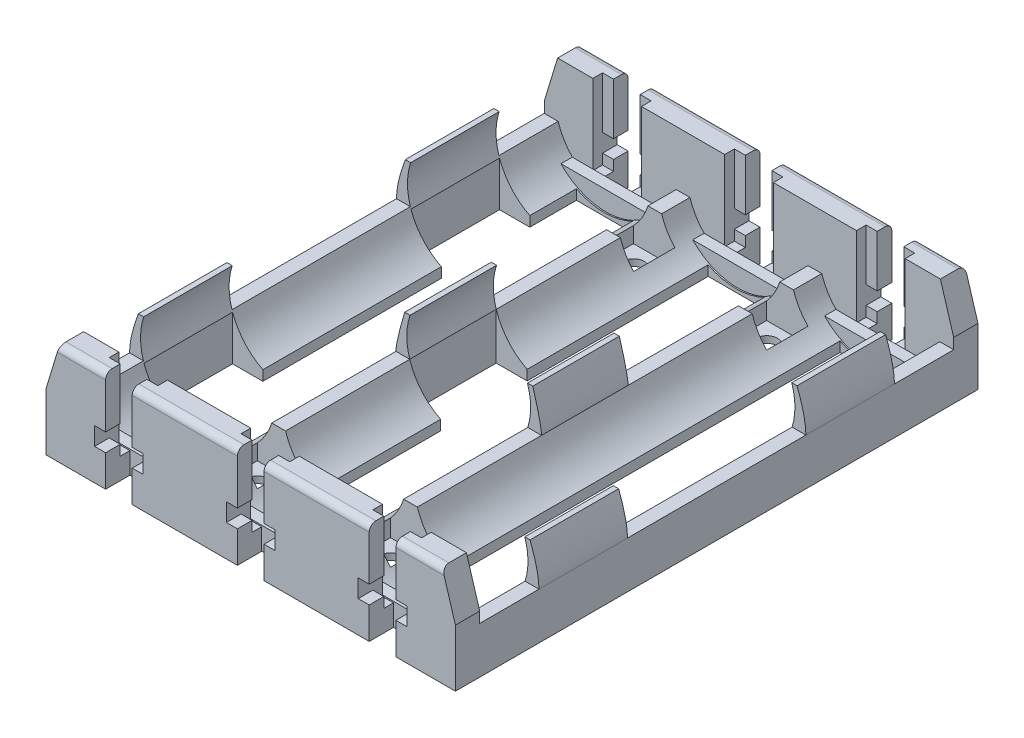
from build123d import *

# Parameters (mm, degrees)
SKETCH1_W                      = 61.5
SKETCH1_H                      = 78.5
BOSS_EXTRUDE1_DEPTH            = 7
BOSS_EXTRUDE2_DEPTH            = 3.65
CUT_EXTRUDE1_REACH             = 54.126
SKETCH3_R                      = 9.3
CUT_EXTRUDE1_DIRECTION_2_REACH = 54.126
SKETCH4_W                      = 8.45
SKETCH4_H                      = 67.4
SKETCH4_W_2                    = 4.55
SKETCH4_H_2                    = 13.3
SKETCH4_W_3                    = 4.643483523
SKETCH4_H_3                    = 13
SKETCH4_R                      = 1.6
CUT_EXTRUDE2_DEPTH             = 53.126432834
SKETCH7_W                      = 6.2
SKETCH7_H                      = 6.2
CUT_EXTRUDE4_DEPTH             = 6
SKETCH6_W                      = 61.5
SKETCH6_H                      = 5.35
BOSS_EXTRUDE3_DEPTH            = 3.4
CUT_EXTRUDE3_DEPTH             = 12
SKETCH8_W                      = 4
SKETCH8_H                      = 3.65
CUT_EXTRUDE5_DEPTH             = 52.28474432
SKETCH9_W                      = 7.3
SKETCH9_H                      = 2.7
CUT_EXTRUDE6_DEPTH             = 86.667102787
BOSS_EXTRUDE4_DEPTH            = 13.3
BOSS_EXTRUDE5_START            = 13.3
BOSS_EXTRUDE5_DEPTH            = 13.3
BOSS_EXTRUDE7_DEPTH            = 13
SKETCH14_R                     = 0.725
BOSS_EXTRUDE8_DEPTH            = 0.9
WRAP1_OUTLINE_W                = 3
WRAP1_OUTLINE_H                = 0.269230769
WRAP1_OUTLINE_W_2              = 2.192307693
WRAP1_OUTLINE_W_3              = 0.307692308
WRAP1_OUTLINE_H_2              = 1.153846154
WRAP1_DEPTH                    = 0.1
FILLET1_R                      = 1


# Read off the part's stored shape, not the designer's step: Wrap1
with BuildPart() as part:
    # Sketch1 → Boss-Extrude1 (new body)
    with BuildSketch(Plane(origin=(0, 0, 0), x_dir=(1, 0, 0), z_dir=(0, 1, 0))):
        Rectangle(SKETCH1_W, SKETCH1_H)
    extrude(amount=BOSS_EXTRUDE1_DEPTH)

    # Sketch2 → Boss-Extrude2 (add)
    with BuildSketch(Plane.XY.offset(39.25)):
        Polygon((-30.75, 0), (-30.75, 8.6), (-28.75, 15.2), (28.75, 15.2), (30.75, 8.6), (30.75, 0), align=None)
    boss_extrude2 = extrude(amount=-BOSS_EXTRUDE2_DEPTH)

    # Mirror1: Boss-Extrude2 across plane
    add(boss_extrude2.mirror(Plane.XY))

    # Cut-Extrude1: up to this face of the body (flat: up to its plane)
    cut_extrude1_end = Plane(part.part.faces().sort_by_distance((0, 11.048930971, 35.6))[0])
    # Sketch3 → Cut-Extrude1 (cut, up to the picked face)
    with BuildSketch(Plane.XY, mode=Mode.PRIVATE) as cut_extrude1_sk1:
        with Locations((0, 9.8)):
            Circle(SKETCH3_R)
    cut_extrude1_tool1 = split(extrude(cut_extrude1_sk1.sketch, amount=CUT_EXTRUDE1_REACH, mode=Mode.PRIVATE), bisect_by=cut_extrude1_end, keep=Keep.BOTH, mode=Mode.PRIVATE)
    # Sketch3 → Cut-Extrude1 (cut, up to the picked face)
    with BuildSketch(Plane.XY, mode=Mode.PRIVATE) as cut_extrude1_sk2:
        with Locations((-19.8, 9.8)):
            Circle(SKETCH3_R)
    cut_extrude1_tool2 = split(extrude(cut_extrude1_sk2.sketch, amount=CUT_EXTRUDE1_REACH, mode=Mode.PRIVATE), bisect_by=cut_extrude1_end, keep=Keep.BOTH, mode=Mode.PRIVATE)
    # Sketch3 → Cut-Extrude1 (cut, up to the picked face)
    with BuildSketch(Plane.XY, mode=Mode.PRIVATE) as cut_extrude1_sk3:
        with Locations((19.8, 9.8)):
            Circle(SKETCH3_R)
    cut_extrude1_tool3 = split(extrude(cut_extrude1_sk3.sketch, amount=CUT_EXTRUDE1_REACH, mode=Mode.PRIVATE), bisect_by=cut_extrude1_end, keep=Keep.BOTH, mode=Mode.PRIVATE)
    add(cut_extrude1_tool1.solids().sort_by(Axis((0, 9.8, 0), (0, 0, 1)))[0], mode=Mode.SUBTRACT)
    add(cut_extrude1_tool2.solids().sort_by(Axis((-19.8, 9.8, 0), (0, 0, 1)))[0], mode=Mode.SUBTRACT)
    add(cut_extrude1_tool3.solids().sort_by(Axis((19.8, 9.8, 0), (0, 0, 1)))[0], mode=Mode.SUBTRACT)

    # Cut-Extrude1 direction 2: up to this face of the body (flat: up to its plane)
    cut_extrude1_direction_2_end = Plane(part.part.faces().sort_by_distance((0, 11.048930971, -35.6))[0])
    # Sketch3 → Cut-Extrude1 direction 2 (cut, up to the picked face)
    with BuildSketch(Plane.XY, mode=Mode.PRIVATE) as cut_extrude1_direction_2_sk1:
        with Locations((0, 9.8)):
            Circle(SKETCH3_R)
    cut_extrude1_direction_2_tool1 = split(extrude(cut_extrude1_direction_2_sk1.sketch, amount=-CUT_EXTRUDE1_DIRECTION_2_REACH, mode=Mode.PRIVATE), bisect_by=cut_extrude1_direction_2_end, keep=Keep.BOTH, mode=Mode.PRIVATE)
    # Sketch3 → Cut-Extrude1 direction 2 (cut, up to the picked face)
    with BuildSketch(Plane.XY, mode=Mode.PRIVATE) as cut_extrude1_direction_2_sk2:
        with Locations((-19.8, 9.8)):
            Circle(SKETCH3_R)
    cut_extrude1_direction_2_tool2 = split(extrude(cut_extrude1_direction_2_sk2.sketch, amount=-CUT_EXTRUDE1_DIRECTION_2_REACH, mode=Mode.PRIVATE), bisect_by=cut_extrude1_direction_2_end, keep=Keep.BOTH, mode=Mode.PRIVATE)
    # Sketch3 → Cut-Extrude1 direction 2 (cut, up to the picked face)
    with BuildSketch(Plane.XY, mode=Mode.PRIVATE) as cut_extrude1_direction_2_sk3:
        with Locations((19.8, 9.8)):
            Circle(SKETCH3_R)
    cut_extrude1_direction_2_tool3 = split(extrude(cut_extrude1_direction_2_sk3.sketch, amount=-CUT_EXTRUDE1_DIRECTION_2_REACH, mode=Mode.PRIVATE), bisect_by=cut_extrude1_direction_2_end, keep=Keep.BOTH, mode=Mode.PRIVATE)
    add(cut_extrude1_direction_2_tool1.solids().sort_by(Axis((0, 9.8, 0), (0, 0, -1)))[0], mode=Mode.SUBTRACT)
    add(cut_extrude1_direction_2_tool2.solids().sort_by(Axis((-19.8, 9.8, 0), (0, 0, -1)))[0], mode=Mode.SUBTRACT)
    add(cut_extrude1_direction_2_tool3.solids().sort_by(Axis((19.8, 9.8, 0), (0, 0, -1)))[0], mode=Mode.SUBTRACT)

    # Sketch4 → Cut-Extrude2 (cut, through all)
    with BuildSketch(Plane.XZ):
        with Locations((-19.8, 0)):
            Rectangle(SKETCH4_W, SKETCH4_H)
        with Locations((-26.3, 20.05)):
            Rectangle(SKETCH4_W_2, SKETCH4_H_2)
        with Locations((-26.3, -20.05)):
            Rectangle(SKETCH4_W_2, SKETCH4_H_2)
        with Locations((-6.546741761, 0)):
            Rectangle(SKETCH4_W_3, SKETCH4_H_3)
        Rectangle(SKETCH4_W, SKETCH4_H)
        with Locations((6.546741761, 0)):
            Rectangle(SKETCH4_W_3, SKETCH4_H_3)
        with Locations((19.8, 0)):
            Rectangle(SKETCH4_W, SKETCH4_H)
        with Locations((26.3, 20.05)):
            Rectangle(SKETCH4_W_2, SKETCH4_H_2)
        with Locations((26.3, -20.05)):
            Rectangle(SKETCH4_W_2, SKETCH4_H_2)
        with Locations(Location((-10, 28.25, 0), (0, 0, 270))):
            Circle(SKETCH4_R)
        with Locations(Location((10, 28.25, 0), (0, 0, 270))):
            Circle(SKETCH4_R)
        with Locations(Location((-10, -28.25, 0), (0, 0, 270))):
            Circle(SKETCH4_R)
        with Locations(Location((10, -28.25, 0), (0, 0, 270))):
            Circle(SKETCH4_R)
    extrude(amount=-CUT_EXTRUDE2_DEPTH, mode=Mode.SUBTRACT)

    # Sketch7 → Cut-Extrude4 (cut)
    with BuildSketch(Plane(origin=(0, 7, 0), x_dir=(1, 0, 0), z_dir=(0, 1, 0))):
        with Locations((-10, 28.25)):
            Rectangle(SKETCH7_W, SKETCH7_H)
        with Locations((10, 28.25)):
            Rectangle(SKETCH7_W, SKETCH7_H)
        with Locations((10, -28.25)):
            Rectangle(SKETCH7_W, SKETCH7_H)
        with Locations((-10, -28.25)):
            Rectangle(SKETCH7_W, SKETCH7_H)
    extrude(amount=-CUT_EXTRUDE4_DEPTH, mode=Mode.SUBTRACT)

    # Sketch6 → Boss-Extrude3 (add)
    with BuildSketch(Plane.XZ):
        with Locations((0, -36.575)):
            Rectangle(SKETCH6_W, SKETCH6_H)
        with Locations((0, 36.575)):
            Rectangle(SKETCH6_W, SKETCH6_H)
    extrude(amount=-BOSS_EXTRUDE3_DEPTH)

    # Sketch5 → Cut-Extrude3 (cut)
    with BuildSketch(Plane(origin=(0, 15.2, 0), x_dir=(1, 0, 0), z_dir=(0, 1, 0))):
        Polygon((-23.45, 35.6), (-23.45, 37.05), (-21.8, 37.05), (-21.8, 39.25), (-17.8, 39.25), (-17.8, 37.05), (-16.15, 37.05), (-16.15, 35.6), align=None)
        Polygon((-3.65, 35.6), (-3.65, 37.05), (-2, 37.05), (-2, 39.25), (2, 39.25), (2, 37.05), (3.65, 37.05), (3.65, 35.6), align=None)
        Polygon((16.15, 35.6), (16.15, 37.05), (17.8, 37.05), (17.8, 39.25), (21.8, 39.25), (21.8, 37.05), (23.45, 37.05), (23.45, 35.6), align=None)
        Polygon((16.15, -35.6), (23.45, -35.6), (23.45, -37.05), (21.8, -37.05), (21.8, -39.25), (17.8, -39.25), (17.8, -37.05), (16.15, -37.05), align=None)
        Polygon((-3.65, -35.6), (3.65, -35.6), (3.65, -37.05), (2, -37.05), (2, -39.25), (-2, -39.25), (-2, -37.05), (-3.65, -37.05), align=None)
        Polygon((-16.15, -35.6), (-16.15, -37.05), (-17.8, -37.05), (-17.8, -39.25), (-21.8, -39.25), (-21.8, -37.05), (-23.45, -37.05), (-23.45, -35.6), align=None)
    extrude(amount=-CUT_EXTRUDE3_DEPTH, mode=Mode.SUBTRACT)

    # Sketch8 → Cut-Extrude5 (cut, through all)
    with BuildSketch(Plane(origin=(0, 3.2, 0), x_dir=(1, 0, 0), z_dir=(0, 1, 0))):
        with Locations((-19.8, 37.425)):
            Rectangle(SKETCH8_W, SKETCH8_H)
        with Locations((0, 37.425)):
            Rectangle(SKETCH8_W, SKETCH8_H)
        with Locations((19.8, 37.425)):
            Rectangle(SKETCH8_W, SKETCH8_H)
        with Locations((-19.8, -37.425)):
            Rectangle(SKETCH8_W, SKETCH8_H)
        with Locations((0, -37.425)):
            Rectangle(SKETCH8_W, SKETCH8_H)
        with Locations((19.8, -37.425)):
            Rectangle(SKETCH8_W, SKETCH8_H)
    extrude(amount=-CUT_EXTRUDE5_DEPTH, mode=Mode.SUBTRACT)

    # Sketch9 → Cut-Extrude6 (cut, through all)
    with BuildSketch(Plane.XY.offset(39.25)):
        with Locations((-19.8, 6.1)):
            Rectangle(SKETCH9_W, SKETCH9_H)
        with Locations((0, 6.1)):
            Rectangle(SKETCH9_W, SKETCH9_H)
        with Locations((19.8, 6.1)):
            Rectangle(SKETCH9_W, SKETCH9_H)
    extrude(amount=-CUT_EXTRUDE6_DEPTH, mode=Mode.SUBTRACT)

    # Sketch10 → Boss-Extrude4 (add)
    with BuildSketch(Plane.XY.offset(-26.7)):
        with BuildLine():
            Line((-28.668483523, 7), (-30.75, 7))
            add(Edge.make_bspline(
                [(-30.75, 7), (-30.75, 9.219569762), (-29.419722218, 12.75)],
                knots=[0, 0, 0, 1, 1, 1], degree=2))
            Line((-29.419722218, 12.75), (-28.619722218, 12.75))
            ThreePointArc((-28.619722218, 12.75), (-29.099665617, 9.878863276), (-28.668483523, 7))
        make_face()
        with BuildLine():
            Line((29.419722218, 12.75), (28.619722218, 12.75))
            ThreePointArc((28.619722218, 12.75), (29.099665617, 9.878863276), (28.668483523, 7))
            Line((28.668483523, 7), (30.75, 7))
            add(Edge.make_bspline(
                [(30.75, 7), (30.75, 9.219569762), (29.419722218, 12.75)],
                knots=[0, 0, 0, 1, 1, 1], degree=2))
        make_face()
    extrude(amount=BOSS_EXTRUDE4_DEPTH)

    # Sketch11 → Boss-Extrude5 (add)
    with BuildSketch(Plane(origin=(0, 0, 26.7), x_dir=(-1, 0, 0), z_dir=(0, 0, -1)).offset(BOSS_EXTRUDE5_START)):
        with BuildLine():
            Line((28.668483523, 7), (30.75, 7))
            add(Edge.make_bspline(
                [(30.75, 7), (30.75, 9.219569768), (29.41972221, 12.750000021)],
                knots=[0, 0, 0, 1, 1, 1], degree=2))
            Line((29.41972221, 12.750000021), (28.619722218, 12.75))
            ThreePointArc((28.619722218, 12.75), (29.099665617, 9.878863276), (28.668483523, 7))
        make_face()
        with BuildLine():
            Line((-28.619722218, 12.75), (-29.419722218, 12.75))
            add(Edge.make_bspline(
                [(-29.419722218, 12.75), (-30.75, 9.219569762), (-30.75, 7)],
                knots=[0, 0, 0, 1, 1, 1], degree=2))
            Line((-30.75, 7), (-28.668483523, 7))
            ThreePointArc((-28.668483523, 7), (-29.099665617, 9.878863276), (-28.619722218, 12.75))
        make_face()
    extrude(amount=-BOSS_EXTRUDE5_DEPTH)

    # Sketch13 → Boss-Extrude7 (add)
    with BuildSketch(Plane.XY.offset(-6.5)):
        with BuildLine():
            Line((-10.931516477, 7), (-8.868483523, 7))
            ThreePointArc((-8.868483523, 7), (-9.299665617, 9.878863276), (-8.819722218, 12.75))
            Line((-8.819722218, 12.75), (-9.619722218, 12.75))
            add(Edge.make_bspline(
                [(-10.931516477, 7), (-10.931516477, 8.305537982), (-9.619722218, 12.75)],
                knots=[0, 0, 0, 1, 1, 1], degree=2))
        make_face()
        with BuildLine():
            Line((8.819722218, 12.75), (9.619722218, 12.75))
            add(Edge.make_bspline(
                [(10.931516477, 7), (10.931516477, 8.305537982), (9.619722218, 12.75)],
                knots=[0, 0, 0, 1, 1, 1], degree=2))
            Line((10.931516477, 7), (8.868483523, 7))
            ThreePointArc((8.868483523, 7), (9.299665617, 9.878863276), (8.819722218, 12.75))
        make_face()
    extrude(amount=BOSS_EXTRUDE7_DEPTH)

    # Sketch14 → Boss-Extrude8 (add)
    with BuildSketch(Plane.XZ):
        with Locations(Location((-27.85, 36.35, 0), (0, 0, 90))):
            Circle(SKETCH14_R)
    extrude(amount=BOSS_EXTRUDE8_DEPTH)

    # Wrap1 outline → Wrap1 (add)
    # profile 1 of 19: a face of its own
    with BuildSketch(Plane.XZ):
        with BuildLine():
            add(Edge.make_bspline(
                [(-11.566626863, -16.209812051), (-11.751117703, -16.225297601), (-12.119936822, -16.256255056), (-12.643114884, -16.574624246), (-13.068112696, -17.10104244), (-13.117598594, -17.57095043), (-13.142348017, -17.805965897)],
                knots=[0, 0, 0, 0, 0.22042865, 0.440663071, 0.720258365, 1, 1, 1, 1], degree=3))
            add(Edge.make_bspline(
                [(-13.142348017, -17.805965897), (-13.124214407, -17.987854162), (-13.087944376, -18.351658878), (-12.773789792, -18.86996631), (-12.246520729, -19.280544656), (-11.783680066, -19.335949223), (-11.552203787, -19.363658204)],
                knots=[0, 0, 0, 0, 0.220319519, 0.440673179, 0.720268979, 1, 1, 1, 1], degree=3))
            add(Edge.make_bspline(
                [(-11.552203787, -19.363658204), (-11.36970047, -19.347512507), (-11.004761052, -19.315227058), (-10.48974599, -18.996488434), (-10.065686356, -18.47932206), (-10.014229189, -18.014384733), (-9.988501863, -17.781927435)],
                knots=[0, 0, 0, 0, 0.220363612, 0.440646063, 0.720336705, 1, 1, 1, 1], degree=3))
            add(Edge.make_bspline(
                [(-9.988501863, -17.781927435), (-10.004172718, -17.599071212), (-10.035501164, -17.233513531), (-10.352654736, -16.716647882), (-10.868282073, -16.2889856), (-11.333873699, -16.23620001), (-11.566626863, -16.209812051)],
                knots=[0, 0, 0, 0, 0.220417275, 0.440647992, 0.720375232, 1, 1, 1, 1], degree=3))
        make_face()
        with BuildLine():
            add(Edge.make_bspline(
                [(-12.83465571, -17.792744743), (-12.777606236, -17.496456186), (-12.683935036, -17.009971341), (-12.134869079, -16.548952544), (-11.756458057, -16.502348091), (-11.567227825, -16.47904282)],
                knots=[0, 0, 0, 0, 0.43782334, 0.718874943, 1, 1, 1, 1], degree=3))
            add(Edge.make_bspline(
                [(-11.567227825, -16.47904282), (-11.268161078, -16.539144726), (-10.776193348, -16.638012949), (-10.362793763, -17.226062298), (-10.318401145, -17.603790095), (-10.296194171, -17.792744743)],
                knots=[0, 0, 0, 0, 0.436559263, 0.718144265, 1, 1, 1, 1], degree=3))
            add(Edge.make_bspline(
                [(-10.296194171, -17.792744743), (-10.35249173, -18.08620325), (-10.445040725, -18.568627183), (-10.990339435, -19.024680792), (-11.36577479, -19.071185719), (-11.55340571, -19.094427435)],
                knots=[0, 0, 0, 0, 0.437205081, 0.718732595, 1, 1, 1, 1], degree=3))
            add(Edge.make_bspline(
                [(-11.55340571, -19.094427435), (-11.850671206, -19.034142078), (-12.339758493, -18.934955318), (-12.760668418, -18.356727827), (-12.809995329, -17.980723478), (-12.83465571, -17.792744743)],
                knots=[0, 0, 0, 0, 0.436602165, 0.718336204, 1, 1, 1, 1], degree=3))
        make_face(mode=Mode.SUBTRACT)
    # profile 2 of 19: a face of its own
    with BuildSketch(Plane.XZ):
        with BuildLine():
            Line((-10.06542494, -13.671350512), (-11.450040325, -14.773513974))
            add(Edge.make_bspline(
                [(-11.450040325, -14.773513974), (-11.459019449, -14.546682265), (-11.473684287, -14.176217364), (-11.834024495, -13.764497934), (-12.119985172, -13.728055612), (-12.263141287, -13.709812051)],
                knots=[0, 0, 0, 0, 0.440919364, 0.720116024, 1, 1, 1, 1], degree=3))
            add(Edge.make_bspline(
                [(-12.263141287, -13.709812051), (-12.423518371, -13.732699589), (-12.786209689, -13.784459548), (-12.939212482, -14.124628443), (-13.024559556, -14.314379358)],
                knots=[0, 0, 0, 0, 0.442186169, 1, 1, 1, 1], degree=3))
            add(Edge.make_bspline(
                [(-13.024559556, -14.314379358), (-13.037390559, -14.413564849), (-13.066567822, -14.639109272), (-13.065835318, -14.866611235), (-13.06542494, -14.994066858)],
                knots=[0, 0, 0, 0, 0.439760335, 1, 1, 1, 1], degree=3))
            Line((-13.06542494, -14.994066858), (-13.06542494, -15.594427435))
            Line((-13.06542494, -15.594427435), (-10.06542494, -15.594427435))
            Line((-10.06542494, -15.594427435), (-10.06542494, -15.325196666))
            Line((-10.06542494, -15.325196666), (-11.450040325, -15.325196666))
            Line((-11.450040325, -15.325196666), (-11.450040325, -15.106446666))
            Line((-11.450040325, -15.106446666), (-10.06542494, -14.004283204))
            Line((-10.06542494, -14.004283204), (-10.06542494, -13.671350512))
        make_face()
        with BuildLine():
            Line((-12.757732633, -15.325196666), (-12.757732633, -14.762696666))
            add(Edge.make_bspline(
                [(-12.757732633, -14.762696666), (-12.761223195, -14.582696651), (-12.766452474, -14.31303516), (-12.526525245, -14.023832671), (-12.351280658, -13.993963239), (-12.263742248, -13.97904282)],
                knots=[0, 0, 0, 0, 0.501181356, 0.750829446, 1, 1, 1, 1], degree=3))
            add(Edge.make_bspline(
                [(-12.263742248, -13.97904282), (-12.173922184, -13.993183962), (-11.994261383, -14.021469501), (-11.750514172, -14.318074414), (-11.752320068, -14.592606897), (-11.753525902, -14.77591782)],
                knots=[0, 0, 0, 0, 0.249363761, 0.498784916, 1, 1, 1, 1], degree=3))
            Line((-11.753525902, -14.77591782), (-11.757732633, -15.325196666))
            Line((-11.757732633, -15.325196666), (-12.757732633, -15.325196666))
        make_face(mode=Mode.SUBTRACT)
    # profile 3 of 19: a face of its own
    with BuildSketch(Plane.XZ):
        with BuildLine():
            add(Edge.make_bspline(
                [(-12.948838402, -9.709812051), (-13.005743705, -9.723500529), (-13.134789106, -9.754542191), (-13.164307771, -9.886978347), (-13.180809556, -9.961013974)],
                knots=[0, 0, 0, 0, 0.440971187, 1, 1, 1, 1], degree=3))
            add(Edge.make_bspline(
                [(-13.180809556, -9.961013974), (-13.170804064, -10.018640591), (-13.148302298, -10.148239491), (-13.020058264, -10.187827174), (-12.948838402, -10.209812051)],
                knots=[0, 0, 0, 0, 0.444653605, 1, 1, 1, 1], degree=3))
            add(Edge.make_bspline(
                [(-12.948838402, -10.209812051), (-12.89272251, -10.195968493), (-12.765498861, -10.164582946), (-12.735845135, -10.033999555), (-12.719271094, -9.961013974)],
                knots=[0, 0, 0, 0, 0.441080669, 1, 1, 1, 1], degree=3))
            add(Edge.make_bspline(
                [(-12.719271094, -9.961013974), (-12.728912753, -9.90338234), (-12.750584356, -9.773843436), (-12.878070579, -9.73266839), (-12.948838402, -9.709812051)],
                knots=[0, 0, 0, 0, 0.444898268, 1, 1, 1, 1], degree=3))
        make_face()
    # profile 4 of 19: a face of its own
    with BuildSketch(Plane.XZ):
        with BuildLine():
            add(Edge.make_bspline(
                [(-10.026963402, -5.843225512), (-10.076678837, -5.582168908), (-10.158499848, -5.152525378), (-10.659370697, -4.772425027), (-10.990236478, -4.730674614), (-11.155569171, -4.709812051)],
                knots=[0, 0, 0, 0, 0.436530256, 0.718435765, 1, 1, 1, 1], degree=3))
            add(Edge.make_bspline(
                [(-11.155569171, -4.709812051), (-11.282624887, -4.719087156), (-11.570874594, -4.740129472), (-11.804416051, -4.913398129), (-11.935016287, -5.01029282)],
                knots=[0, 0, 0, 0, 0.440783502, 1, 1, 1, 1], degree=3))
            add(Edge.make_bspline(
                [(-11.935016287, -5.01029282), (-12.029676414, -5.113344909), (-12.244413632, -5.347119355), (-12.277623709, -5.665303057), (-12.296194171, -5.843225512)],
                knots=[0, 0, 0, 0, 0.440818453, 1, 1, 1, 1], degree=3))
            add(Edge.make_bspline(
                [(-12.296194171, -5.843225512), (-12.285400457, -5.983258191), (-12.260931559, -6.300706417), (-12.05070492, -6.54309555), (-11.933213402, -6.678562051)],
                knots=[0, 0, 0, 0, 0.441119741, 1, 1, 1, 1], degree=3))
            add(Edge.make_bspline(
                [(-11.933213402, -6.678562051), (-11.833092905, -6.756879597), (-11.605909147, -6.934590207), (-11.317099581, -6.963098313), (-11.155569171, -6.97904282)],
                knots=[0, 0, 0, 0, 0.440702704, 1, 1, 1, 1], degree=3))
            add(Edge.make_bspline(
                [(-11.155569171, -6.97904282), (-10.896044644, -6.925476869), (-10.469405271, -6.837418358), (-10.078851193, -6.343111219), (-10.044267012, -6.00992807), (-10.026963402, -5.843225512)],
                knots=[0, 0, 0, 0, 0.436926873, 0.718275876, 1, 1, 1, 1], degree=3))
        make_face()
        with BuildLine():
            add(Edge.make_bspline(
                [(-12.026963402, -5.844427435), (-11.984353163, -5.64636705), (-11.914229197, -5.320417701), (-11.535197753, -5.024428473), (-11.280878812, -4.994167647), (-11.153766287, -4.97904282)],
                knots=[0, 0, 0, 0, 0.436502568, 0.718355301, 1, 1, 1, 1], degree=3))
            add(Edge.make_bspline(
                [(-11.153766287, -4.97904282), (-10.947000051, -5.019633411), (-10.48061678, -5.111189814), (-10.362143525, -5.582222342), (-10.296194171, -5.844427435)],
                knots=[0, 0, 0, 0, 0.443339733, 1, 1, 1, 1], degree=3))
            add(Edge.make_bspline(
                [(-10.296194171, -5.844427435), (-10.334518462, -6.051782156), (-10.420989209, -6.519634715), (-10.891685226, -6.64179426), (-11.153766287, -6.709812051)],
                knots=[0, 0, 0, 0, 0.443205271, 1, 1, 1, 1], degree=3))
            add(Edge.make_bspline(
                [(-11.153766287, -6.709812051), (-11.352405472, -6.669053425), (-11.679190687, -6.602000612), (-11.979197792, -6.225659316), (-12.011046997, -5.971461111), (-12.026963402, -5.844427435)],
                knots=[0, 0, 0, 0, 0.436762215, 0.718526077, 1, 1, 1, 1], degree=3))
        make_face(mode=Mode.SUBTRACT)
    # profile 5 of 19: a face of its own
    with BuildSketch(Plane.XZ):
        with BuildLine():
            add(Edge.make_bspline(
                [(-10.85809321, -3.902119743), (-10.944852683, -3.902224429), (-11.141879967, -3.902462167), (-11.33715013, -3.875655789), (-11.446434556, -3.860653397)],
                knots=[0, 0, 0, 0, 0.440342428, 1, 1, 1, 1], degree=3))
            add(Edge.make_bspline(
                [(-11.446434556, -3.860653397), (-11.587372701, -3.797184001), (-11.905837573, -3.653768087), (-11.9836097, -3.3077476), (-12.026963402, -3.114860128)],
                knots=[0, 0, 0, 0, 0.44255476, 1, 1, 1, 1], degree=3))
            add(Edge.make_bspline(
                [(-12.026963402, -3.114860128), (-12.015603273, -2.994636075), (-11.990015605, -2.723842232), (-11.736458594, -2.611706353), (-11.595473017, -2.54935532)],
                knots=[0, 0, 0, 0, 0.44396893, 1, 1, 1, 1], degree=3))
            add(Edge.make_bspline(
                [(-11.595473017, -2.54935532), (-11.522744594, -2.539145944), (-11.357357221, -2.515929412), (-11.190280407, -2.516938828), (-11.09667494, -2.517504358)],
                knots=[0, 0, 0, 0, 0.43974592, 1, 1, 1, 1], degree=3))
            Line((-11.09667494, -2.517504358), (-10.06542494, -2.517504358))
            Line((-10.06542494, -2.517504358), (-10.06542494, -2.248273589))
            Line((-10.06542494, -2.248273589), (-11.185016287, -2.248273589))
            add(Edge.make_bspline(
                [(-11.185016287, -2.248273589), (-11.421407314, -2.249421067), (-11.807300809, -2.251294251), (-12.234938689, -2.625117561), (-12.275761736, -2.920261813), (-12.296194171, -3.067985128)],
                knots=[0, 0, 0, 0, 0.441272869, 0.720350226, 1, 1, 1, 1], degree=3))
            add(Edge.make_bspline(
                [(-12.296194171, -3.067985128), (-12.281064923, -3.214045692), (-12.246745159, -3.545375042), (-12.000174419, -3.774179565), (-11.86229994, -3.902119743)],
                knots=[0, 0, 0, 0, 0.440831955, 1, 1, 1, 1], degree=3))
            Line((-11.86229994, -3.902119743), (-12.257732633, -3.902119743))
            Line((-12.257732633, -3.902119743), (-12.257732633, -4.171350512))
            Line((-12.257732633, -4.171350512), (-10.06542494, -4.171350512))
            Line((-10.06542494, -4.171350512), (-10.06542494, -3.902119743))
            Line((-10.06542494, -3.902119743), (-10.85809321, -3.902119743))
        make_face()
    # profile 6 of 19: a face of its own
    with BuildSketch(Plane.XZ):
        with BuildLine():
            add(Edge.make_bspline(
                [(-12.372516287, 1.790187949), (-12.251332526, 1.810611172), (-11.975839051, 1.857040367), (-11.822556034, 2.095001727), (-11.736698979, 2.228288911)],
                knots=[0, 0, 0, 0, 0.439878877, 1, 1, 1, 1], degree=3))
            add(Edge.make_bspline(
                [(-11.736698979, 2.228288911), (-11.657520909, 2.085309508), (-11.479409791, 1.763677251), (-11.116284204, 1.681813552), (-10.914583594, 1.636341796)],
                knots=[0, 0, 0, 0, 0.444543109, 1, 1, 1, 1], degree=3))
            add(Edge.make_bspline(
                [(-10.914583594, 1.636341796), (-10.690316551, 1.686921535), (-10.321833105, 1.770026909), (-10.016410708, 2.220122403), (-9.997824983, 2.507306336), (-9.988501863, 2.651365834)],
                knots=[0, 0, 0, 0, 0.43662127, 0.717393461, 1, 1, 1, 1], degree=3))
            add(Edge.make_bspline(
                [(-9.988501863, 2.651365834), (-9.995359511, 2.784730694), (-10.010866057, 3.086295953), (-10.207920255, 3.318260063), (-10.317828787, 3.447639872)],
                knots=[0, 0, 0, 0, 0.442242124, 1, 1, 1, 1], degree=3))
            add(Edge.make_bspline(
                [(-10.317828787, 3.447639872), (-10.399002691, 3.506882767), (-10.58320894, 3.641321432), (-10.81152094, 3.662793392), (-10.939223017, 3.674803334)],
                knots=[0, 0, 0, 0, 0.440668567, 1, 1, 1, 1], degree=3))
            add(Edge.make_bspline(
                [(-10.939223017, 3.674803334), (-11.094840301, 3.648014524), (-11.449388546, 3.586980652), (-11.633434141, 3.271747426), (-11.736698979, 3.094875449)],
                knots=[0, 0, 0, 0, 0.438917088, 1, 1, 1, 1], degree=3))
            add(Edge.make_bspline(
                [(-11.736698979, 3.094875449), (-11.799787442, 3.198763912), (-11.941935376, 3.43284047), (-12.213220284, 3.48946429), (-12.364102825, 3.52095718)],
                knots=[0, 0, 0, 0, 0.44382258, 1, 1, 1, 1], degree=3))
            add(Edge.make_bspline(
                [(-12.364102825, 3.52095718), (-12.55566968, 3.47348634), (-12.989965364, 3.365866568), (-13.087715338, 2.919095839), (-13.142348017, 2.66939468)],
                knots=[0, 0, 0, 0, 0.441097765, 1, 1, 1, 1], degree=3))
            add(Edge.make_bspline(
                [(-13.142348017, 2.66939468), (-13.112922114, 2.470727359), (-13.046901506, 2.02499297), (-12.61301575, 1.873924188), (-12.372516287, 1.790187949)],
                knots=[0, 0, 0, 0, 0.44570786, 1, 1, 1, 1], degree=3))
        make_face()
        with BuildLine():
            add(Edge.make_bspline(
                [(-12.83465571, 2.654370642), (-12.825231719, 2.785376051), (-12.804201094, 3.077728376), (-12.527196046, 3.189848313), (-12.374319171, 3.251726411)],
                knots=[0, 0, 0, 0, 0.44810798, 1, 1, 1, 1], degree=3))
            add(Edge.make_bspline(
                [(-12.374319171, 3.251726411), (-12.248692122, 3.214967243), (-11.962971612, 3.131363845), (-11.905384285, 2.832593453), (-11.873117248, 2.665187949)],
                knots=[0, 0, 0, 0, 0.439685094, 1, 1, 1, 1], degree=3))
            add(Edge.make_bspline(
                [(-11.873117248, 2.665187949), (-11.89202732, 2.533751471), (-11.934359758, 2.239515344), (-12.21373331, 2.123570518), (-12.368309556, 2.059418719)],
                knots=[0, 0, 0, 0, 0.446704081, 1, 1, 1, 1], degree=3))
            add(Edge.make_bspline(
                [(-12.368309556, 2.059418719), (-12.490102122, 2.099187578), (-12.768697128, 2.190157051), (-12.810901628, 2.487190461), (-12.83465571, 2.654370642)],
                knots=[0, 0, 0, 0, 0.437167083, 1, 1, 1, 1], degree=3))
        make_face(mode=Mode.SUBTRACT)
        with BuildLine():
            add(Edge.make_bspline(
                [(-11.56542494, 2.671798526), (-11.541039954, 2.835722494), (-11.486363824, 3.203273571), (-11.130800264, 3.333452235), (-10.933814363, 3.405572565)],
                knots=[0, 0, 0, 0, 0.445989626, 1, 1, 1, 1], degree=3))
            add(Edge.make_bspline(
                [(-10.933814363, 3.405572565), (-10.770203, 3.361448873), (-10.398234376, 3.261134149), (-10.332830169, 2.872219932), (-10.296194171, 2.654370642)],
                knots=[0, 0, 0, 0, 0.439852591, 1, 1, 1, 1], degree=3))
            add(Edge.make_bspline(
                [(-10.296194171, 2.654370642), (-10.311708691, 2.486356452), (-10.346328951, 2.111437028), (-10.706695289, 1.978780935), (-10.905569171, 1.905572565)],
                knots=[0, 0, 0, 0, 0.448134131, 1, 1, 1, 1], degree=3))
            add(Edge.make_bspline(
                [(-10.905569171, 1.905572565), (-11.071366507, 1.952051425), (-11.448533589, 2.057784704), (-11.523444058, 2.451278859), (-11.56542494, 2.671798526)],
                knots=[0, 0, 0, 0, 0.439585913, 1, 1, 1, 1], degree=3))
        make_face(mode=Mode.SUBTRACT)
    # profile 7 of 19: a face of its own
    with BuildSketch(Plane.XZ):
        with BuildLine():
            add(Edge.make_bspline(
                [(-9.988501863, 5.006534103), (-10.028584534, 5.221071012), (-10.094406123, 5.573371902), (-10.498306636, 5.896910461), (-10.770973422, 5.928321212), (-10.907372056, 5.944034103)],
                knots=[0, 0, 0, 0, 0.437654663, 0.718692779, 1, 1, 1, 1], degree=3))
            add(Edge.make_bspline(
                [(-10.907372056, 5.944034103), (-11.111814027, 5.903426553), (-11.448135705, 5.836624225), (-11.750213315, 5.445564033), (-11.780868222, 5.184920169), (-11.796194171, 5.054611026)],
                knots=[0, 0, 0, 0, 0.43667806, 0.718366671, 1, 1, 1, 1], degree=3))
            add(Edge.make_bspline(
                [(-11.796194171, 5.054611026), (-11.795086096, 5.008759393), (-11.792568257, 4.904572377), (-11.776400507, 4.801580258), (-11.767348017, 4.743913911)],
                knots=[0, 0, 0, 0, 0.440089706, 1, 1, 1, 1], degree=3))
            Line((-11.767348017, 4.743913911), (-12.97948744, 5.53658218))
            Line((-12.97948744, 5.53658218), (-13.142348017, 5.328649488))
            Line((-13.142348017, 5.328649488), (-11.773357633, 4.433216796))
            add(Edge.make_bspline(
                [(-11.773357633, 4.433216796), (-11.656483528, 4.355545068), (-11.391898996, 4.179708533), (-11.077489671, 4.12719638), (-10.901963402, 4.097880257)],
                knots=[0, 0, 0, 0, 0.441726901, 1, 1, 1, 1], degree=3))
            add(Edge.make_bspline(
                [(-10.901963402, 4.097880257), (-10.691487945, 4.138371874), (-10.345725317, 4.204890261), (-10.037363108, 4.606764505), (-10.004792836, 4.873245733), (-9.988501863, 5.006534103)],
                knots=[0, 0, 0, 0, 0.437445392, 0.718621881, 1, 1, 1, 1], degree=3))
        make_face()
        with BuildLine():
            add(Edge.make_bspline(
                [(-11.488501863, 4.998120642), (-11.465708798, 5.152116851), (-11.414626447, 5.497243248), (-11.077722634, 5.611518158), (-10.891146094, 5.674803334)],
                knots=[0, 0, 0, 0, 0.44620235, 1, 1, 1, 1], degree=3))
            add(Edge.make_bspline(
                [(-10.891146094, 5.674803334), (-10.7444055, 5.638433158), (-10.411322327, 5.555877313), (-10.337496085, 5.212858327), (-10.296194171, 5.02095718)],
                knots=[0, 0, 0, 0, 0.440552407, 1, 1, 1, 1], degree=3))
            add(Edge.make_bspline(
                [(-10.296194171, 5.02095718), (-10.320288695, 4.870482623), (-10.374385229, 4.532640216), (-10.70679255, 4.426163278), (-10.891146094, 4.367111026)],
                knots=[0, 0, 0, 0, 0.445398666, 1, 1, 1, 1], degree=3))
            add(Edge.make_bspline(
                [(-10.891146094, 4.367111026), (-11.038708216, 4.397934551), (-11.372316646, 4.467620373), (-11.44690534, 4.808191427), (-11.488501863, 4.998120642)],
                knots=[0, 0, 0, 0, 0.442321322, 1, 1, 1, 1], degree=3))
        make_face(mode=Mode.SUBTRACT)
    # profile 8 of 19: a face of its own
    with BuildSketch(Plane.XZ):
        with BuildLine():
            add(Edge.make_bspline(
                [(-11.719271094, 7.258937949), (-11.698258318, 7.430905934), (-11.651157554, 7.816377302), (-11.268793691, 7.923283083), (-11.057011479, 7.982495642)],
                knots=[0, 0, 0, 0, 0.446123884, 1, 1, 1, 1], degree=3))
            add(Edge.make_bspline(
                [(-11.057011479, 7.982495642), (-10.874712943, 7.947167636), (-10.462980316, 7.867377129), (-10.355876663, 7.452348262), (-10.296194171, 7.221077372)],
                knots=[0, 0, 0, 0, 0.44275951, 1, 1, 1, 1], degree=3))
            add(Edge.make_bspline(
                [(-10.296194171, 7.221077372), (-10.317399681, 7.079461247), (-10.365157105, 6.760524273), (-10.666896357, 6.631276946), (-10.83465571, 6.559418719)],
                knots=[0, 0, 0, 0, 0.444025426, 1, 1, 1, 1], degree=3))
            Line((-10.83465571, 6.559418719), (-10.83465571, 6.290187949))
            add(Edge.make_bspline(
                [(-10.83465571, 6.290187949), (-10.639088348, 6.346123964), (-10.318167302, 6.437913535), (-10.028956086, 6.822106401), (-10.001989208, 7.077645705), (-9.988501863, 7.205452372)],
                knots=[0, 0, 0, 0, 0.438150576, 0.718993904, 1, 1, 1, 1], degree=3))
            add(Edge.make_bspline(
                [(-9.988501863, 7.205452372), (-10.031332807, 7.4519235), (-10.101756292, 7.857176205), (-10.582190818, 8.198826749), (-10.891047063, 8.234084208), (-11.04559321, 8.251726411)],
                knots=[0, 0, 0, 0, 0.436790889, 0.718180223, 1, 1, 1, 1], degree=3))
            add(Edge.make_bspline(
                [(-11.04559321, 8.251726411), (-11.270395281, 8.215105791), (-11.639665535, 8.15495107), (-11.980674504, 7.734768765), (-12.011527998, 7.450053402), (-12.026963402, 7.307615834)],
                knots=[0, 0, 0, 0, 0.437442651, 0.71856348, 1, 1, 1, 1], degree=3))
            add(Edge.make_bspline(
                [(-12.026963402, 7.307615834), (-12.024357119, 7.254869963), (-12.018432884, 7.134975493), (-11.986534997, 7.019130873), (-11.968670133, 6.954250449)],
                knots=[0, 0, 0, 0, 0.439935812, 1, 1, 1, 1], degree=3))
            Line((-11.968670133, 6.954250449), (-12.757732633, 7.116510065))
            Line((-12.757732633, 7.116510065), (-12.757732633, 8.136341796))
            Line((-12.757732633, 8.136341796), (-13.06542494, 8.136341796))
            Line((-13.06542494, 8.136341796), (-13.06542494, 6.905572565))
            Line((-13.06542494, 6.905572565), (-11.56542494, 6.597880257))
            add(Edge.make_bspline(
                [(-11.56542494, 6.597880257), (-11.601249509, 6.691739372), (-11.682561089, 6.904772867), (-11.706101954, 7.131886765), (-11.719271094, 7.258937949)],
                knots=[0, 0, 0, 0, 0.440583842, 1, 1, 1, 1], degree=3))
        make_face()
    # profile 9 of 19: a face of its own
    with BuildSketch(Plane.XZ):
        with BuildLine():
            add(Edge.make_bspline(
                [(-13.142348017, 9.562423526), (-13.111580444, 9.386667455), (-13.049925938, 9.034473491), (-12.601179084, 8.697789046), (-12.090237114, 8.571857712), (-11.739768439, 8.563569954), (-11.564223017, 8.559418719)],
                knots=[0, 0, 0, 0, 0.248186247, 0.497335298, 0.748221472, 1, 1, 1, 1], degree=3))
            add(Edge.make_bspline(
                [(-11.564223017, 8.559418719), (-11.388891758, 8.563756836), (-11.038847841, 8.572417764), (-10.529802262, 8.700843787), (-10.08001937, 9.034690819), (-10.01896912, 9.386735088), (-9.988501863, 9.562423526)],
                knots=[0, 0, 0, 0, 0.251781042, 0.502673751, 0.751808282, 1, 1, 1, 1], degree=3))
            add(Edge.make_bspline(
                [(-9.988501863, 9.562423526), (-10.0192798, 9.739157253), (-10.080952266, 10.093294211), (-10.52543382, 10.437080758), (-11.034625994, 10.583390098), (-11.387487038, 10.593044632), (-11.564223017, 10.597880257)],
                knots=[0, 0, 0, 0, 0.248266914, 0.497474316, 0.748302142, 1, 1, 1, 1], degree=3))
            add(Edge.make_bspline(
                [(-11.564223017, 10.597880257), (-11.741180268, 10.592930599), (-12.094495565, 10.583048043), (-12.603762988, 10.436388846), (-13.051200115, 10.09469593), (-13.112004112, 9.7396215), (-13.142348017, 9.562423526)],
                knots=[0, 0, 0, 0, 0.251683216, 0.502514195, 0.751732401, 1, 1, 1, 1], degree=3))
        make_face()
        with BuildLine():
            add(Edge.make_bspline(
                [(-11.56542494, 8.828649488), (-11.842562518, 8.83149256), (-12.257552271, 8.835749818), (-12.748205154, 9.159553252), (-12.805887282, 9.434373762), (-12.83465571, 9.571437949)],
                knots=[0, 0, 0, 0, 0.501925063, 0.751589731, 1, 1, 1, 1], degree=3))
            add(Edge.make_bspline(
                [(-12.83465571, 9.571437949), (-12.805412904, 9.708562883), (-12.746761165, 9.983591754), (-12.252633965, 10.299348253), (-11.840537086, 10.31691925), (-11.56542494, 10.328649488)],
                knots=[0, 0, 0, 0, 0.248420542, 0.498252356, 1, 1, 1, 1], degree=3))
            add(Edge.make_bspline(
                [(-11.56542494, 10.328649488), (-11.452670087, 10.326485878), (-11.19664251, 10.321573063), (-10.949512093, 10.253282868), (-10.81121821, 10.215067757)],
                knots=[0, 0, 0, 0, 0.440401208, 1, 1, 1, 1], degree=3))
            add(Edge.make_bspline(
                [(-10.81121821, 10.215067757), (-10.688043854, 10.160366468), (-10.410504565, 10.037112266), (-10.337049332, 9.7378725), (-10.296194171, 9.571437949)],
                knots=[0, 0, 0, 0, 0.443808715, 1, 1, 1, 1], degree=3))
            add(Edge.make_bspline(
                [(-10.296194171, 9.571437949), (-10.325372217, 9.434572246), (-10.383861924, 9.160214096), (-10.873366454, 8.835767415), (-11.288302374, 8.831499736), (-11.56542494, 8.828649488)],
                knots=[0, 0, 0, 0, 0.248469321, 0.498076448, 1, 1, 1, 1], degree=3))
        make_face(mode=Mode.SUBTRACT)
    # profile 10 of 19: a face of its own
    with BuildSketch(Plane.XZ):
        with BuildLine():
            add(Edge.make_bspline(
                [(-10.513141287, 12.516750449), (-10.371919227, 12.668969723), (-10.051103198, 13.014768271), (-10.010969085, 13.488777937), (-9.988501863, 13.754130257)],
                knots=[0, 0, 0, 0, 0.440196394, 1, 1, 1, 1], degree=3))
            add(Edge.make_bspline(
                [(-9.988501863, 13.754130257), (-10.007653631, 13.979119424), (-10.051028988, 14.488679975), (-10.414643092, 14.854898655), (-10.617708594, 15.059418719)],
                knots=[0, 0, 0, 0, 0.441535685, 1, 1, 1, 1], degree=3))
            Line((-10.617708594, 15.059418719), (-10.796194171, 14.823841796))
            add(Edge.make_bspline(
                [(-10.796194171, 14.823841796), (-10.667293218, 14.693914705), (-10.3751517, 14.399447545), (-10.324498033, 13.984300185), (-10.296194171, 13.752327372)],
                knots=[0, 0, 0, 0, 0.441227779, 1, 1, 1, 1], degree=3))
            add(Edge.make_bspline(
                [(-10.296194171, 13.752327372), (-10.345931768, 13.44884282), (-10.427624197, 12.950379048), (-10.98406201, 12.474696223), (-11.369649504, 12.428611942), (-11.562420133, 12.405572565)],
                knots=[0, 0, 0, 0, 0.437678394, 0.718872912, 1, 1, 1, 1], degree=3))
            add(Edge.make_bspline(
                [(-11.562420133, 12.405572565), (-11.863257525, 12.46686247), (-12.358432047, 12.567744875), (-12.768099115, 13.16367486), (-12.812465003, 13.543645676), (-12.83465571, 13.733697565)],
                knots=[0, 0, 0, 0, 0.43621894, 0.718010828, 1, 1, 1, 1], degree=3))
            add(Edge.make_bspline(
                [(-12.83465571, 13.733697565), (-12.819749677, 13.919191514), (-12.78599603, 14.339229312), (-12.496375942, 14.650199779), (-12.33465571, 14.823841796)],
                knots=[0, 0, 0, 0, 0.441612516, 1, 1, 1, 1], degree=3))
            Line((-12.33465571, 14.823841796), (-12.514944171, 15.059418719))
            add(Edge.make_bspline(
                [(-12.514944171, 15.059418719), (-12.679848439, 14.904787235), (-13.054217299, 14.553739849), (-13.110728957, 14.038697728), (-13.142348017, 13.750524488)],
                knots=[0, 0, 0, 0, 0.440486072, 1, 1, 1, 1], degree=3))
            add(Edge.make_bspline(
                [(-13.142348017, 13.750524488), (-13.128668852, 13.565776993), (-13.101331092, 13.196559808), (-12.803362305, 12.662335028), (-12.288335506, 12.21853764), (-11.817998049, 12.163738585), (-11.582852825, 12.136341796)],
                knots=[0, 0, 0, 0, 0.220626064, 0.440920374, 0.720488126, 1, 1, 1, 1], degree=3))
            add(Edge.make_bspline(
                [(-11.582852825, 12.136341796), (-11.410546267, 12.146785857), (-11.019810536, 12.170469622), (-10.694818439, 12.392584014), (-10.513141287, 12.516750449)],
                knots=[0, 0, 0, 0, 0.440979785, 1, 1, 1, 1], degree=3))
        make_face()
    # profile 11 of 19: a face of its own
    with BuildSketch(Plane.XZ):
        Polygon((-11.526963402, -19.748273589), (-11.83465571, -19.748273589), (-11.83465571, -20.940581281), (-12.757732633, -20.940581281), (-12.757732633, -19.748273589), (-13.06542494, -19.748273589), (-13.06542494, -21.209812051), (-10.06542494, -21.209812051), (-10.06542494, -20.940581281), (-11.526963402, -20.940581281), align=None)
    # profile 12 of 19: a face of its own
    with BuildSketch(Plane.XZ):
        Polygon((-11.83465571, 17.367111026), (-11.83465571, 15.944034103), (-12.757732633, 15.944034103), (-12.757732633, 17.367111026), (-13.06542494, 17.367111026), (-13.06542494, 15.674803334), (-10.06542494, 15.674803334), (-10.06542494, 17.367111026), (-10.373117248, 17.367111026), (-10.373117248, 15.944034103), (-11.526963402, 15.944034103), (-11.526963402, 17.367111026), align=None)
    # profile 13 of 19: a face of its own
    with BuildSketch(Plane.XZ):
        Polygon((-12.757732633, -0.209812051), (-12.757732633, 0.251726411), (-10.06542494, 0.251726411), (-10.06542494, 0.52095718), (-13.06542494, 0.52095718), (-13.06542494, -0.03373032), align=None)
    # profile 14 of 19: a face of its own
    with BuildSketch(Plane.XZ):
        Polygon((-13.06542494, -11.632888974), (-13.06542494, -11.902119743), (-10.06542494, -11.902119743), (-10.06542494, -10.47904282), (-10.373117248, -10.47904282), (-10.373117248, -11.632888974), align=None)
    # profile 15 of 19: a face of its own
    with BuildSketch(Plane.XZ):
        with Locations((-11.56542494, -7.613658205)):
            Rectangle(WRAP1_OUTLINE_W, WRAP1_OUTLINE_H)
    # profile 16 of 19: a face of its own
    with BuildSketch(Plane.XZ):
        Polygon((-13.06542494, 18.174803334), (-13.06542494, 17.905572565), (-10.06542494, 17.905572565), (-10.06542494, 19.328649488), (-10.373117248, 19.328649488), (-10.373117248, 18.174803334), align=None)
    # profile 17 of 19: a face of its own
    with BuildSketch(Plane.XZ):
        Polygon((-13.06542494, 20.097880257), (-13.06542494, 19.828649488), (-10.06542494, 19.828649488), (-10.06542494, 21.251726411), (-10.373117248, 21.251726411), (-10.373117248, 20.097880257), align=None)
    # profile 18 of 19: a face of its own
    with BuildSketch(Plane.XZ):
        with Locations((-11.161578787, -9.959812051)):
            Rectangle(WRAP1_OUTLINE_W_2, WRAP1_OUTLINE_H)
    # profile 19 of 19: a face of its own
    with BuildSketch(Plane.XZ):
        with Locations((-11.219271094, -8.825196666)):
            Rectangle(WRAP1_OUTLINE_W_3, WRAP1_OUTLINE_H_2)
    extrude(amount=WRAP1_DEPTH)

    # Fillet1
    fillet1_edges = [part.edges().sort_by_distance(p)[0] for p in [
        (25.275, 15.2, 39.25),
        (25.275, 15.2, -39.25),
        (9.9, 15.2, -39.25),
        (-9.9, 15.2, -39.25),
        (-25.275, 15.2, -39.25),
        (9.9, 15.2, 39.25),
        (-9.9, 15.2, 39.25),
        (-25.275, 15.2, 39.25),
    ]]
    fillet(fillet1_edges, radius=FILLET1_R)


solid = part.part
